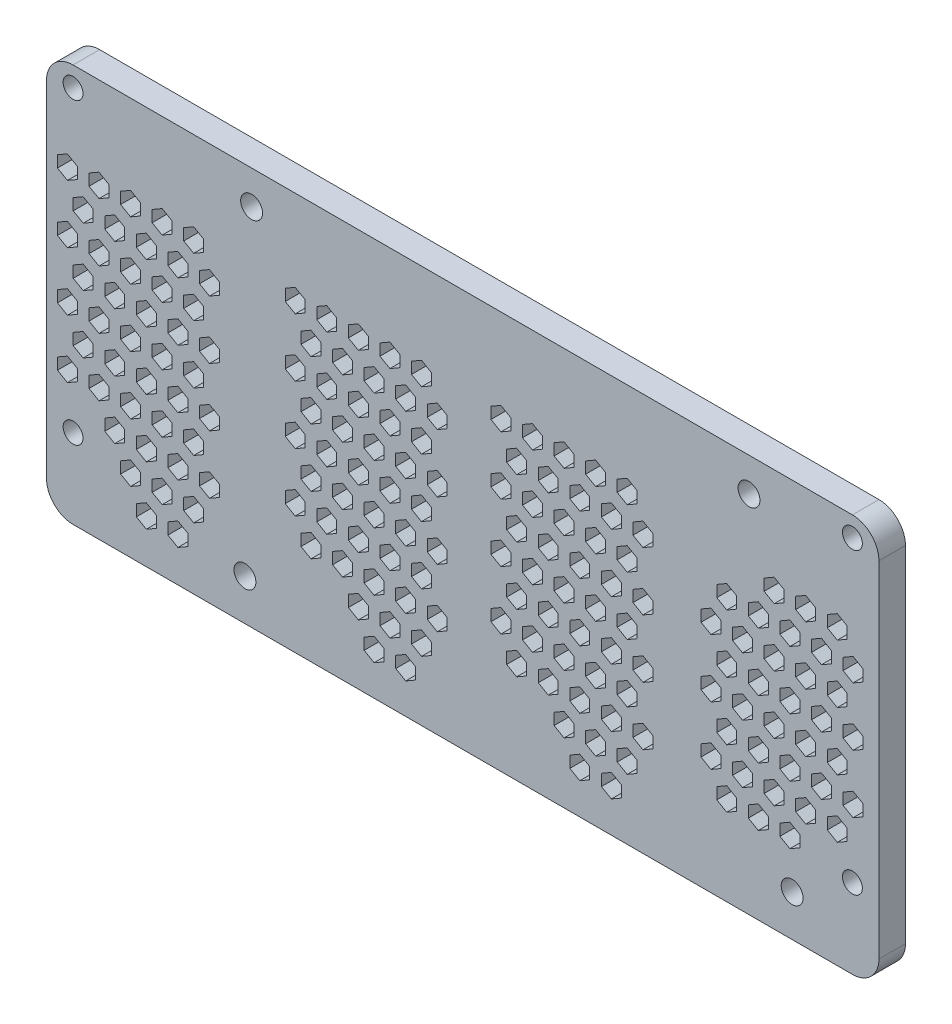
from build123d import *

# Parameters (mm, degrees)
SKETCH1_R           = 1.5
SKETCH1_R_2         = 1.65
BOSS_EXTRUDE5_DEPTH = 4


with BuildPart() as part:
    # Sketch1 → Boss-Extrude5 (new body)
    with BuildSketch(Plane.XY):
        with BuildLine():
            Line((-44, 25.588235294), (73.5, 25.588235294))
            ThreePointArc((73.5, 25.588235294), (76.328427125, 24.416662419), (77.5, 21.588235294))
            Line((77.5, 21.588235294), (77.5, -30.411764706))
            ThreePointArc((77.5, -30.411764706), (76.328427125, -33.240191831), (73.5, -34.411764706))
            Line((73.5, -34.411764706), (-44, -34.411764706))
            ThreePointArc((-44, -34.411764706), (-46.828427125, -33.240191831), (-48, -30.411764706))
            Line((-48, -30.411764706), (-48, 21.588235294))
            ThreePointArc((-48, 21.588235294), (-46.828427125, 24.416662419), (-44, 25.588235294))
        make_face()
        with Locations((-44, 22.588235294)):
            Circle(SKETCH1_R, mode=Mode.SUBTRACT)
        with Locations((73.5, 22.588235294)):
            Circle(SKETCH1_R, mode=Mode.SUBTRACT)
        with Locations((-44, -22.411764706)):
            Circle(SKETCH1_R, mode=Mode.SUBTRACT)
        with Locations((73.5, -22.411764706)):
            Circle(SKETCH1_R, mode=Mode.SUBTRACT)
        with Locations((-17.085026636, 20.514793381)):
            Circle(SKETCH1_R_2, mode=Mode.SUBTRACT)
        with Locations((-18.085026636, -28.185206619)):
            Circle(SKETCH1_R_2, mode=Mode.SUBTRACT)
        with Locations((57.914973364, 20.514793381)):
            Circle(SKETCH1_R_2, mode=Mode.SUBTRACT)
        with Locations((64.414973364, -28.181764706)):
            Circle(SKETCH1_R_2, mode=Mode.SUBTRACT)
        Polygon((-44.8542361, 13.546846171), (-46.3542361, 12.680820767), (-46.3542361, 10.948769959), (-44.8542361, 10.082744555), (-43.3542361, 10.948769959), (-43.3542361, 12.680820767), align=None, mode=Mode.SUBTRACT)
        Polygon((-42.478591753, 9.144922382), (-43.978591753, 8.278896978), (-43.978591753, 6.546846171), (-42.478591753, 5.680820767), (-40.978591753, 6.546846171), (-40.978591753, 8.278896978), align=None, mode=Mode.SUBTRACT)
        Polygon((-40.0942361, 13.546846171), (-41.5942361, 12.680820767), (-41.5942361, 10.948769959), (-40.0942361, 10.082744555), (-38.5942361, 10.948769959), (-38.5942361, 12.680820767), align=None, mode=Mode.SUBTRACT)
        Polygon((-37.718591753, 9.144922382), (-39.218591753, 8.278896978), (-39.218591753, 6.546846171), (-37.718591753, 5.680820767), (-36.218591753, 6.546846171), (-36.218591753, 8.278896978), align=None, mode=Mode.SUBTRACT)
        Polygon((-35.3342361, 13.546846171), (-36.8342361, 12.680820767), (-36.8342361, 10.948769959), (-35.3342361, 10.082744555), (-33.8342361, 10.948769959), (-33.8342361, 12.680820767), align=None, mode=Mode.SUBTRACT)
        Polygon((-32.958591753, 9.144922382), (-34.458591753, 8.278896978), (-34.458591753, 6.546846171), (-32.958591753, 5.680820767), (-31.458591753, 6.546846171), (-31.458591753, 8.278896978), align=None, mode=Mode.SUBTRACT)
        Polygon((-30.5742361, 13.546846171), (-32.0742361, 12.680820767), (-32.0742361, 10.948769959), (-30.5742361, 10.082744555), (-29.0742361, 10.948769959), (-29.0742361, 12.680820767), align=None, mode=Mode.SUBTRACT)
        Polygon((-28.198591753, 9.144922382), (-29.698591753, 8.278896978), (-29.698591753, 6.546846171), (-28.198591753, 5.680820767), (-26.698591753, 6.546846171), (-26.698591753, 8.278896978), align=None, mode=Mode.SUBTRACT)
        Polygon((-25.8142361, 13.546846171), (-27.3142361, 12.680820767), (-27.3142361, 10.948769959), (-25.8142361, 10.082744555), (-24.3142361, 10.948769959), (-24.3142361, 12.680820767), align=None, mode=Mode.SUBTRACT)
        Polygon((-23.438591753, 9.144922382), (-24.938591753, 8.278896978), (-24.938591753, 6.546846171), (-23.438591753, 5.680820767), (-21.938591753, 6.546846171), (-21.938591753, 8.278896978), align=None, mode=Mode.SUBTRACT)
        Polygon((-40.0942361, 4.746846171), (-41.5942361, 3.880820767), (-41.5942361, 2.148769959), (-40.0942361, 1.282744555), (-38.5942361, 2.148769959), (-38.5942361, 3.880820767), align=None, mode=Mode.SUBTRACT)
        Polygon((-37.718591753, 0.344922382), (-39.218591753, -0.521103022), (-39.218591753, -2.253153829), (-37.718591753, -3.119179233), (-36.218591753, -2.253153829), (-36.218591753, -0.521103022), align=None, mode=Mode.SUBTRACT)
        Polygon((-35.3342361, 4.746846171), (-36.8342361, 3.880820767), (-36.8342361, 2.148769959), (-35.3342361, 1.282744555), (-33.8342361, 2.148769959), (-33.8342361, 3.880820767), align=None, mode=Mode.SUBTRACT)
        Polygon((-32.958591753, 0.344922382), (-34.458591753, -0.521103022), (-34.458591753, -2.253153829), (-32.958591753, -3.119179233), (-31.458591753, -2.253153829), (-31.458591753, -0.521103022), align=None, mode=Mode.SUBTRACT)
        Polygon((-30.5742361, 4.746846171), (-32.0742361, 3.880820767), (-32.0742361, 2.148769959), (-30.5742361, 1.282744555), (-29.0742361, 2.148769959), (-29.0742361, 3.880820767), align=None, mode=Mode.SUBTRACT)
        Polygon((-28.198591753, 0.344922382), (-29.698591753, -0.521103022), (-29.698591753, -2.253153829), (-28.198591753, -3.119179233), (-26.698591753, -2.253153829), (-26.698591753, -0.521103022), align=None, mode=Mode.SUBTRACT)
        Polygon((-25.8142361, 4.746846171), (-27.3142361, 3.880820767), (-27.3142361, 2.148769959), (-25.8142361, 1.282744555), (-24.3142361, 2.148769959), (-24.3142361, 3.880820767), align=None, mode=Mode.SUBTRACT)
        Polygon((-23.438591753, 0.344922382), (-24.938591753, -0.521103022), (-24.938591753, -2.253153829), (-23.438591753, -3.119179233), (-21.938591753, -2.253153829), (-21.938591753, -0.521103022), align=None, mode=Mode.SUBTRACT)
        Polygon((-40.0942361, -4.053153829), (-41.5942361, -4.919179233), (-41.5942361, -6.651230041), (-40.0942361, -7.517255445), (-38.5942361, -6.651230041), (-38.5942361, -4.919179233), align=None, mode=Mode.SUBTRACT)
        Polygon((-37.718591753, -8.455077618), (-39.218591753, -9.321103022), (-39.218591753, -11.053153829), (-37.718591753, -11.919179233), (-36.218591753, -11.053153829), (-36.218591753, -9.321103022), align=None, mode=Mode.SUBTRACT)
        Polygon((-35.3342361, -4.053153829), (-36.8342361, -4.919179233), (-36.8342361, -6.651230041), (-35.3342361, -7.517255445), (-33.8342361, -6.651230041), (-33.8342361, -4.919179233), align=None, mode=Mode.SUBTRACT)
        Polygon((-32.958591753, -8.455077618), (-34.458591753, -9.321103022), (-34.458591753, -11.053153829), (-32.958591753, -11.919179233), (-31.458591753, -11.053153829), (-31.458591753, -9.321103022), align=None, mode=Mode.SUBTRACT)
        Polygon((-30.5742361, -4.053153829), (-32.0742361, -4.919179233), (-32.0742361, -6.651230041), (-30.5742361, -7.517255445), (-29.0742361, -6.651230041), (-29.0742361, -4.919179233), align=None, mode=Mode.SUBTRACT)
        Polygon((-28.198591753, -8.455077618), (-29.698591753, -9.321103022), (-29.698591753, -11.053153829), (-28.198591753, -11.919179233), (-26.698591753, -11.053153829), (-26.698591753, -9.321103022), align=None, mode=Mode.SUBTRACT)
        Polygon((-25.8142361, -4.053153829), (-27.3142361, -4.919179233), (-27.3142361, -6.651230041), (-25.8142361, -7.517255445), (-24.3142361, -6.651230041), (-24.3142361, -4.919179233), align=None, mode=Mode.SUBTRACT)
        Polygon((-23.438591753, -8.455077618), (-24.938591753, -9.321103022), (-24.938591753, -11.053153829), (-23.438591753, -11.919179233), (-21.938591753, -11.053153829), (-21.938591753, -9.321103022), align=None, mode=Mode.SUBTRACT)
        Polygon((-40.0942361, -12.853153829), (-41.5942361, -13.719179233), (-41.5942361, -15.451230041), (-40.0942361, -16.317255445), (-38.5942361, -15.451230041), (-38.5942361, -13.719179233), align=None, mode=Mode.SUBTRACT)
        Polygon((-37.718591753, -17.255077618), (-39.218591753, -18.121103022), (-39.218591753, -19.853153829), (-37.718591753, -20.719179233), (-36.218591753, -19.853153829), (-36.218591753, -18.121103022), align=None, mode=Mode.SUBTRACT)
        Polygon((-35.3342361, -12.853153829), (-36.8342361, -13.719179233), (-36.8342361, -15.451230041), (-35.3342361, -16.317255445), (-33.8342361, -15.451230041), (-33.8342361, -13.719179233), align=None, mode=Mode.SUBTRACT)
        Polygon((-32.958591753, -17.255077618), (-34.458591753, -18.121103022), (-34.458591753, -19.853153829), (-32.958591753, -20.719179233), (-31.458591753, -19.853153829), (-31.458591753, -18.121103022), align=None, mode=Mode.SUBTRACT)
        Polygon((-30.5742361, -12.853153829), (-32.0742361, -13.719179233), (-32.0742361, -15.451230041), (-30.5742361, -16.317255445), (-29.0742361, -15.451230041), (-29.0742361, -13.719179233), align=None, mode=Mode.SUBTRACT)
        Polygon((-28.198591753, -17.255077618), (-29.698591753, -18.121103022), (-29.698591753, -19.853153829), (-28.198591753, -20.719179233), (-26.698591753, -19.853153829), (-26.698591753, -18.121103022), align=None, mode=Mode.SUBTRACT)
        Polygon((-25.8142361, -12.853153829), (-27.3142361, -13.719179233), (-27.3142361, -15.451230041), (-25.8142361, -16.317255445), (-24.3142361, -15.451230041), (-24.3142361, -13.719179233), align=None, mode=Mode.SUBTRACT)
        Polygon((-23.438591753, -17.255077618), (-24.938591753, -18.121103022), (-24.938591753, -19.853153829), (-23.438591753, -20.719179233), (-21.938591753, -19.853153829), (-21.938591753, -18.121103022), align=None, mode=Mode.SUBTRACT)
        Polygon((-35.3342361, -21.653153829), (-36.8342361, -22.519179233), (-36.8342361, -24.251230041), (-35.3342361, -25.117255445), (-33.8342361, -24.251230041), (-33.8342361, -22.519179233), align=None, mode=Mode.SUBTRACT)
        Polygon((-32.958591753, -26.055077618), (-34.458591753, -26.921103022), (-34.458591753, -28.653153829), (-32.958591753, -29.519179233), (-31.458591753, -28.653153829), (-31.458591753, -26.921103022), align=None, mode=Mode.SUBTRACT)
        Polygon((-30.5742361, -21.653153829), (-32.0742361, -22.519179233), (-32.0742361, -24.251230041), (-30.5742361, -25.117255445), (-29.0742361, -24.251230041), (-29.0742361, -22.519179233), align=None, mode=Mode.SUBTRACT)
        Polygon((-28.198591753, -26.055077618), (-29.698591753, -26.921103022), (-29.698591753, -28.653153829), (-28.198591753, -29.519179233), (-26.698591753, -28.653153829), (-26.698591753, -26.921103022), align=None, mode=Mode.SUBTRACT)
        Polygon((-25.8142361, -21.653153829), (-27.3142361, -22.519179233), (-27.3142361, -24.251230041), (-25.8142361, -25.117255445), (-24.3142361, -24.251230041), (-24.3142361, -22.519179233), align=None, mode=Mode.SUBTRACT)
        Polygon((-44.8542361, 4.746846171), (-46.3542361, 3.880820767), (-46.3542361, 2.148769959), (-44.8542361, 1.282744555), (-43.3542361, 2.148769959), (-43.3542361, 3.880820767), align=None, mode=Mode.SUBTRACT)
        Polygon((-42.478591753, 0.344922382), (-43.978591753, -0.521103022), (-43.978591753, -2.253153829), (-42.478591753, -3.119179233), (-40.978591753, -2.253153829), (-40.978591753, -0.521103022), align=None, mode=Mode.SUBTRACT)
        Polygon((-44.8542361, -4.053153829), (-46.3542361, -4.919179233), (-46.3542361, -6.651230041), (-44.8542361, -7.517255445), (-43.3542361, -6.651230041), (-43.3542361, -4.919179233), align=None, mode=Mode.SUBTRACT)
        Polygon((-42.478591753, -8.455077618), (-43.978591753, -9.321103022), (-43.978591753, -11.053153829), (-42.478591753, -11.919179233), (-40.978591753, -11.053153829), (-40.978591753, -9.321103022), align=None, mode=Mode.SUBTRACT)
        Polygon((-44.8542361, -12.853153829), (-46.3542361, -13.719179233), (-46.3542361, -15.451230041), (-44.8542361, -16.317255445), (-43.3542361, -15.451230041), (-43.3542361, -13.719179233), align=None, mode=Mode.SUBTRACT)
        Polygon((54.553412934, 7.152031374), (53.053412934, 6.28600597), (53.053412934, 4.553955163), (54.553412934, 3.687929759), (56.053412934, 4.553955163), (56.053412934, 6.28600597), align=None, mode=Mode.SUBTRACT)
        Polygon((59.313412934, 7.152031374), (57.813412934, 6.28600597), (57.813412934, 4.553955163), (59.313412934, 3.687929759), (60.813412934, 4.553955163), (60.813412934, 6.28600597), align=None, mode=Mode.SUBTRACT)
        Polygon((61.697768587, 11.553955163), (60.197768587, 10.687929759), (60.197768587, 8.955878952), (61.697768587, 8.089853548), (63.197768587, 8.955878952), (63.197768587, 10.687929759), align=None, mode=Mode.SUBTRACT)
        Polygon((64.073412934, 7.152031374), (62.573412934, 6.28600597), (62.573412934, 4.553955163), (64.073412934, 3.687929759), (65.573412934, 4.553955163), (65.573412934, 6.28600597), align=None, mode=Mode.SUBTRACT)
        Polygon((66.457768587, 11.553955163), (64.957768587, 10.687929759), (64.957768587, 8.955878952), (66.457768587, 8.089853548), (67.957768587, 8.955878952), (67.957768587, 10.687929759), align=None, mode=Mode.SUBTRACT)
        Polygon((68.833412934, 7.152031374), (67.333412934, 6.28600597), (67.333412934, 4.553955163), (68.833412934, 3.687929759), (70.333412934, 4.553955163), (70.333412934, 6.28600597), align=None, mode=Mode.SUBTRACT)
        Polygon((71.217768587, 11.553955163), (69.717768587, 10.687929759), (69.717768587, 8.955878952), (71.217768587, 8.089853548), (72.717768587, 8.955878952), (72.717768587, 10.687929759), align=None, mode=Mode.SUBTRACT)
        Polygon((73.593412934, 7.152031374), (72.093412934, 6.28600597), (72.093412934, 4.553955163), (73.593412934, 3.687929759), (75.093412934, 4.553955163), (75.093412934, 6.28600597), align=None, mode=Mode.SUBTRACT)
        Polygon((56.937768587, 2.753955163), (55.437768587, 1.887929759), (55.437768587, 0.155878952), (56.937768587, -0.710146452), (58.437768587, 0.155878952), (58.437768587, 1.887929759), align=None, mode=Mode.SUBTRACT)
        Polygon((59.313412934, -1.647968626), (57.813412934, -2.51399403), (57.813412934, -4.246044837), (59.313412934, -5.112070241), (60.813412934, -4.246044837), (60.813412934, -2.51399403), align=None, mode=Mode.SUBTRACT)
        Polygon((61.697768587, 2.753955163), (60.197768587, 1.887929759), (60.197768587, 0.155878952), (61.697768587, -0.710146452), (63.197768587, 0.155878952), (63.197768587, 1.887929759), align=None, mode=Mode.SUBTRACT)
        Polygon((64.073412934, -1.647968626), (62.573412934, -2.51399403), (62.573412934, -4.246044837), (64.073412934, -5.112070241), (65.573412934, -4.246044837), (65.573412934, -2.51399403), align=None, mode=Mode.SUBTRACT)
        Polygon((66.457768587, 2.753955163), (64.957768587, 1.887929759), (64.957768587, 0.155878952), (66.457768587, -0.710146452), (67.957768587, 0.155878952), (67.957768587, 1.887929759), align=None, mode=Mode.SUBTRACT)
        Polygon((68.833412934, -1.647968626), (67.333412934, -2.51399403), (67.333412934, -4.246044837), (68.833412934, -5.112070241), (70.333412934, -4.246044837), (70.333412934, -2.51399403), align=None, mode=Mode.SUBTRACT)
        Polygon((71.217768587, 2.753955163), (69.717768587, 1.887929759), (69.717768587, 0.155878952), (71.217768587, -0.710146452), (72.717768587, 0.155878952), (72.717768587, 1.887929759), align=None, mode=Mode.SUBTRACT)
        Polygon((73.593412934, -1.647968626), (72.093412934, -2.51399403), (72.093412934, -4.246044837), (73.593412934, -5.112070241), (75.093412934, -4.246044837), (75.093412934, -2.51399403), align=None, mode=Mode.SUBTRACT)
        Polygon((56.937768587, -6.046044837), (55.437768587, -6.912070241), (55.437768587, -8.644121048), (56.937768587, -9.510146452), (58.437768587, -8.644121048), (58.437768587, -6.912070241), align=None, mode=Mode.SUBTRACT)
        Polygon((59.313412934, -10.447968626), (57.813412934, -11.31399403), (57.813412934, -13.046044837), (59.313412934, -13.912070241), (60.813412934, -13.046044837), (60.813412934, -11.31399403), align=None, mode=Mode.SUBTRACT)
        Polygon((61.697768587, -6.046044837), (60.197768587, -6.912070241), (60.197768587, -8.644121048), (61.697768587, -9.510146452), (63.197768587, -8.644121048), (63.197768587, -6.912070241), align=None, mode=Mode.SUBTRACT)
        Polygon((64.073412934, -10.447968626), (62.573412934, -11.31399403), (62.573412934, -13.046044837), (64.073412934, -13.912070241), (65.573412934, -13.046044837), (65.573412934, -11.31399403), align=None, mode=Mode.SUBTRACT)
        Polygon((66.457768587, -6.046044837), (64.957768587, -6.912070241), (64.957768587, -8.644121048), (66.457768587, -9.510146452), (67.957768587, -8.644121048), (67.957768587, -6.912070241), align=None, mode=Mode.SUBTRACT)
        Polygon((68.833412934, -10.447968626), (67.333412934, -11.31399403), (67.333412934, -13.046044837), (68.833412934, -13.912070241), (70.333412934, -13.046044837), (70.333412934, -11.31399403), align=None, mode=Mode.SUBTRACT)
        Polygon((71.217768587, -6.046044837), (69.717768587, -6.912070241), (69.717768587, -8.644121048), (71.217768587, -9.510146452), (72.717768587, -8.644121048), (72.717768587, -6.912070241), align=None, mode=Mode.SUBTRACT)
        Polygon((73.593412934, -10.447968626), (72.093412934, -11.31399403), (72.093412934, -13.046044837), (73.593412934, -13.912070241), (75.093412934, -13.046044837), (75.093412934, -11.31399403), align=None, mode=Mode.SUBTRACT)
        Polygon((56.937768587, -14.846044837), (55.437768587, -15.712070241), (55.437768587, -17.444121048), (56.937768587, -18.310146452), (58.437768587, -17.444121048), (58.437768587, -15.712070241), align=None, mode=Mode.SUBTRACT)
        Polygon((59.313412934, -19.247968626), (57.813412934, -20.11399403), (57.813412934, -21.846044837), (59.313412934, -22.712070241), (60.813412934, -21.846044837), (60.813412934, -20.11399403), align=None, mode=Mode.SUBTRACT)
        Polygon((61.697768587, -14.846044837), (60.197768587, -15.712070241), (60.197768587, -17.444121048), (61.697768587, -18.310146452), (63.197768587, -17.444121048), (63.197768587, -15.712070241), align=None, mode=Mode.SUBTRACT)
        Polygon((64.073412934, -19.247968626), (62.573412934, -20.11399403), (62.573412934, -21.846044837), (64.073412934, -22.712070241), (65.573412934, -21.846044837), (65.573412934, -20.11399403), align=None, mode=Mode.SUBTRACT)
        Polygon((66.457768587, -14.846044837), (64.957768587, -15.712070241), (64.957768587, -17.444121048), (66.457768587, -18.310146452), (67.957768587, -17.444121048), (67.957768587, -15.712070241), align=None, mode=Mode.SUBTRACT)
        Polygon((71.217768587, -14.846044837), (69.717768587, -15.712070241), (69.717768587, -17.444121048), (71.217768587, -18.310146452), (72.717768587, -17.444121048), (72.717768587, -15.712070241), align=None, mode=Mode.SUBTRACT)
        Polygon((52.177768587, 2.753955163), (50.677768587, 1.887929759), (50.677768587, 0.155878952), (52.177768587, -0.710146452), (53.677768587, 0.155878952), (53.677768587, 1.887929759), align=None, mode=Mode.SUBTRACT)
        Polygon((54.553412934, -1.647968626), (53.053412934, -2.51399403), (53.053412934, -4.246044837), (54.553412934, -5.112070241), (56.053412934, -4.246044837), (56.053412934, -2.51399403), align=None, mode=Mode.SUBTRACT)
        Polygon((52.177768587, -6.046044837), (50.677768587, -6.912070241), (50.677768587, -8.644121048), (52.177768587, -9.510146452), (53.677768587, -8.644121048), (53.677768587, -6.912070241), align=None, mode=Mode.SUBTRACT)
        Polygon((54.553412934, -10.447968626), (53.053412934, -11.31399403), (53.053412934, -13.046044837), (54.553412934, -13.912070241), (56.053412934, -13.046044837), (56.053412934, -11.31399403), align=None, mode=Mode.SUBTRACT)
        Polygon((52.177768587, -14.846044837), (50.677768587, -15.712070241), (50.677768587, -17.444121048), (52.177768587, -18.310146452), (53.677768587, -17.444121048), (53.677768587, -15.712070241), align=None, mode=Mode.SUBTRACT)
        Polygon((54.553412934, -19.247968626), (53.053412934, -20.11399403), (53.053412934, -21.846044837), (54.553412934, -22.712070241), (56.053412934, -21.846044837), (56.053412934, -20.11399403), align=None, mode=Mode.SUBTRACT)
        Polygon((-10.509250981, 13.292308193), (-12.009250981, 12.426282789), (-12.009250981, 10.694231982), (-10.509250981, 9.828206578), (-9.009250981, 10.694231982), (-9.009250981, 12.426282789), align=None, mode=Mode.SUBTRACT)
        Polygon((-8.133606634, 8.890384404), (-9.633606634, 8.024359001), (-9.633606634, 6.292308193), (-8.133606634, 5.426282789), (-6.633606634, 6.292308193), (-6.633606634, 8.024359001), align=None, mode=Mode.SUBTRACT)
        Polygon((-5.749250981, 13.292308193), (-7.249250981, 12.426282789), (-7.249250981, 10.694231982), (-5.749250981, 9.828206578), (-4.249250981, 10.694231982), (-4.249250981, 12.426282789), align=None, mode=Mode.SUBTRACT)
        Polygon((-3.373606634, 8.890384404), (-4.873606634, 8.024359001), (-4.873606634, 6.292308193), (-3.373606634, 5.426282789), (-1.873606634, 6.292308193), (-1.873606634, 8.024359001), align=None, mode=Mode.SUBTRACT)
        Polygon((-0.989250981, 13.292308193), (-2.489250981, 12.426282789), (-2.489250981, 10.694231982), (-0.989250981, 9.828206578), (0.510749019, 10.694231982), (0.510749019, 12.426282789), align=None, mode=Mode.SUBTRACT)
        Polygon((1.386393366, 8.890384404), (-0.113606634, 8.024359001), (-0.113606634, 6.292308193), (1.386393366, 5.426282789), (2.886393366, 6.292308193), (2.886393366, 8.024359001), align=None, mode=Mode.SUBTRACT)
        Polygon((3.770749019, 13.292308193), (2.270749019, 12.426282789), (2.270749019, 10.694231982), (3.770749019, 9.828206578), (5.270749019, 10.694231982), (5.270749019, 12.426282789), align=None, mode=Mode.SUBTRACT)
        Polygon((6.146393366, 8.890384404), (4.646393366, 8.024359001), (4.646393366, 6.292308193), (6.146393366, 5.426282789), (7.646393366, 6.292308193), (7.646393366, 8.024359001), align=None, mode=Mode.SUBTRACT)
        Polygon((8.530749019, 13.292308193), (7.030749019, 12.426282789), (7.030749019, 10.694231982), (8.530749019, 9.828206578), (10.030749019, 10.694231982), (10.030749019, 12.426282789), align=None, mode=Mode.SUBTRACT)
        Polygon((10.906393366, 8.890384404), (9.406393366, 8.024359001), (9.406393366, 6.292308193), (10.906393366, 5.426282789), (12.406393366, 6.292308193), (12.406393366, 8.024359001), align=None, mode=Mode.SUBTRACT)
        Polygon((-5.749250981, 4.492308193), (-7.249250981, 3.626282789), (-7.249250981, 1.894231982), (-5.749250981, 1.028206578), (-4.249250981, 1.894231982), (-4.249250981, 3.626282789), align=None, mode=Mode.SUBTRACT)
        Polygon((-3.373606634, 0.090384404), (-4.873606634, -0.775640999), (-4.873606634, -2.507691807), (-3.373606634, -3.373717211), (-1.873606634, -2.507691807), (-1.873606634, -0.775640999), align=None, mode=Mode.SUBTRACT)
        Polygon((-0.989250981, 4.492308193), (-2.489250981, 3.626282789), (-2.489250981, 1.894231982), (-0.989250981, 1.028206578), (0.510749019, 1.894231982), (0.510749019, 3.626282789), align=None, mode=Mode.SUBTRACT)
        Polygon((1.386393366, 0.090384404), (-0.113606634, -0.775640999), (-0.113606634, -2.507691807), (1.386393366, -3.373717211), (2.886393366, -2.507691807), (2.886393366, -0.775640999), align=None, mode=Mode.SUBTRACT)
        Polygon((3.770749019, 4.492308193), (2.270749019, 3.626282789), (2.270749019, 1.894231982), (3.770749019, 1.028206578), (5.270749019, 1.894231982), (5.270749019, 3.626282789), align=None, mode=Mode.SUBTRACT)
        Polygon((6.146393366, 0.090384404), (4.646393366, -0.775640999), (4.646393366, -2.507691807), (6.146393366, -3.373717211), (7.646393366, -2.507691807), (7.646393366, -0.775640999), align=None, mode=Mode.SUBTRACT)
        Polygon((8.530749019, 4.492308193), (7.030749019, 3.626282789), (7.030749019, 1.894231982), (8.530749019, 1.028206578), (10.030749019, 1.894231982), (10.030749019, 3.626282789), align=None, mode=Mode.SUBTRACT)
        Polygon((10.906393366, 0.090384404), (9.406393366, -0.775640999), (9.406393366, -2.507691807), (10.906393366, -3.373717211), (12.406393366, -2.507691807), (12.406393366, -0.775640999), align=None, mode=Mode.SUBTRACT)
        Polygon((-5.749250981, -4.307691807), (-7.249250981, -5.173717211), (-7.249250981, -6.905768018), (-5.749250981, -7.771793422), (-4.249250981, -6.905768018), (-4.249250981, -5.173717211), align=None, mode=Mode.SUBTRACT)
        Polygon((-3.373606634, -8.709615596), (-4.873606634, -9.575640999), (-4.873606634, -11.307691807), (-3.373606634, -12.173717211), (-1.873606634, -11.307691807), (-1.873606634, -9.575640999), align=None, mode=Mode.SUBTRACT)
        Polygon((-0.989250981, -4.307691807), (-2.489250981, -5.173717211), (-2.489250981, -6.905768018), (-0.989250981, -7.771793422), (0.510749019, -6.905768018), (0.510749019, -5.173717211), align=None, mode=Mode.SUBTRACT)
        Polygon((1.386393366, -8.709615596), (-0.113606634, -9.575640999), (-0.113606634, -11.307691807), (1.386393366, -12.173717211), (2.886393366, -11.307691807), (2.886393366, -9.575640999), align=None, mode=Mode.SUBTRACT)
        Polygon((3.770749019, -4.307691807), (2.270749019, -5.173717211), (2.270749019, -6.905768018), (3.770749019, -7.771793422), (5.270749019, -6.905768018), (5.270749019, -5.173717211), align=None, mode=Mode.SUBTRACT)
        Polygon((6.146393366, -8.709615596), (4.646393366, -9.575640999), (4.646393366, -11.307691807), (6.146393366, -12.173717211), (7.646393366, -11.307691807), (7.646393366, -9.575640999), align=None, mode=Mode.SUBTRACT)
        Polygon((8.530749019, -4.307691807), (7.030749019, -5.173717211), (7.030749019, -6.905768018), (8.530749019, -7.771793422), (10.030749019, -6.905768018), (10.030749019, -5.173717211), align=None, mode=Mode.SUBTRACT)
        Polygon((10.906393366, -8.709615596), (9.406393366, -9.575640999), (9.406393366, -11.307691807), (10.906393366, -12.173717211), (12.406393366, -11.307691807), (12.406393366, -9.575640999), align=None, mode=Mode.SUBTRACT)
        Polygon((-5.749250981, -13.107691807), (-7.249250981, -13.973717211), (-7.249250981, -15.705768018), (-5.749250981, -16.571793422), (-4.249250981, -15.705768018), (-4.249250981, -13.973717211), align=None, mode=Mode.SUBTRACT)
        Polygon((-3.373606634, -17.509615596), (-4.873606634, -18.375640999), (-4.873606634, -20.107691807), (-3.373606634, -20.973717211), (-1.873606634, -20.107691807), (-1.873606634, -18.375640999), align=None, mode=Mode.SUBTRACT)
        Polygon((-0.989250981, -13.107691807), (-2.489250981, -13.973717211), (-2.489250981, -15.705768018), (-0.989250981, -16.571793422), (0.510749019, -15.705768018), (0.510749019, -13.973717211), align=None, mode=Mode.SUBTRACT)
        Polygon((1.386393366, -17.509615596), (-0.113606634, -18.375640999), (-0.113606634, -20.107691807), (1.386393366, -20.973717211), (2.886393366, -20.107691807), (2.886393366, -18.375640999), align=None, mode=Mode.SUBTRACT)
        Polygon((3.770749019, -13.107691807), (2.270749019, -13.973717211), (2.270749019, -15.705768018), (3.770749019, -16.571793422), (5.270749019, -15.705768018), (5.270749019, -13.973717211), align=None, mode=Mode.SUBTRACT)
        Polygon((6.146393366, -17.509615596), (4.646393366, -18.375640999), (4.646393366, -20.107691807), (6.146393366, -20.973717211), (7.646393366, -20.107691807), (7.646393366, -18.375640999), align=None, mode=Mode.SUBTRACT)
        Polygon((8.530749019, -13.107691807), (7.030749019, -13.973717211), (7.030749019, -15.705768018), (8.530749019, -16.571793422), (10.030749019, -15.705768018), (10.030749019, -13.973717211), align=None, mode=Mode.SUBTRACT)
        Polygon((10.906393366, -17.509615596), (9.406393366, -18.375640999), (9.406393366, -20.107691807), (10.906393366, -20.973717211), (12.406393366, -20.107691807), (12.406393366, -18.375640999), align=None, mode=Mode.SUBTRACT)
        Polygon((-0.989250981, -21.907691807), (-2.489250981, -22.773717211), (-2.489250981, -24.505768018), (-0.989250981, -25.371793422), (0.510749019, -24.505768018), (0.510749019, -22.773717211), align=None, mode=Mode.SUBTRACT)
        Polygon((1.386393366, -26.309615596), (-0.113606634, -27.175640999), (-0.113606634, -28.907691807), (1.386393366, -29.773717211), (2.886393366, -28.907691807), (2.886393366, -27.175640999), align=None, mode=Mode.SUBTRACT)
        Polygon((3.770749019, -21.907691807), (2.270749019, -22.773717211), (2.270749019, -24.505768018), (3.770749019, -25.371793422), (5.270749019, -24.505768018), (5.270749019, -22.773717211), align=None, mode=Mode.SUBTRACT)
        Polygon((6.146393366, -26.309615596), (4.646393366, -27.175640999), (4.646393366, -28.907691807), (6.146393366, -29.773717211), (7.646393366, -28.907691807), (7.646393366, -27.175640999), align=None, mode=Mode.SUBTRACT)
        Polygon((8.530749019, -21.907691807), (7.030749019, -22.773717211), (7.030749019, -24.505768018), (8.530749019, -25.371793422), (10.030749019, -24.505768018), (10.030749019, -22.773717211), align=None, mode=Mode.SUBTRACT)
        Polygon((-10.509250981, 4.492308193), (-12.009250981, 3.626282789), (-12.009250981, 1.894231982), (-10.509250981, 1.028206578), (-9.009250981, 1.894231982), (-9.009250981, 3.626282789), align=None, mode=Mode.SUBTRACT)
        Polygon((-8.133606634, 0.090384404), (-9.633606634, -0.775640999), (-9.633606634, -2.507691807), (-8.133606634, -3.373717211), (-6.633606634, -2.507691807), (-6.633606634, -0.775640999), align=None, mode=Mode.SUBTRACT)
        Polygon((-10.509250981, -4.307691807), (-12.009250981, -5.173717211), (-12.009250981, -6.905768018), (-10.509250981, -7.771793422), (-9.009250981, -6.905768018), (-9.009250981, -5.173717211), align=None, mode=Mode.SUBTRACT)
        Polygon((-8.133606634, -8.709615596), (-9.633606634, -9.575640999), (-9.633606634, -11.307691807), (-8.133606634, -12.173717211), (-6.633606634, -11.307691807), (-6.633606634, -9.575640999), align=None, mode=Mode.SUBTRACT)
        Polygon((-10.509250981, -13.107691807), (-12.009250981, -13.973717211), (-12.009250981, -15.705768018), (-10.509250981, -16.571793422), (-9.009250981, -15.705768018), (-9.009250981, -13.973717211), align=None, mode=Mode.SUBTRACT)
        Polygon((-8.133606634, -17.509615596), (-9.633606634, -18.375640999), (-9.633606634, -20.107691807), (-8.133606634, -20.973717211), (-6.633606634, -20.107691807), (-6.633606634, -18.375640999), align=None, mode=Mode.SUBTRACT)
        Polygon((20.504407611, 13.391172594), (19.004407611, 12.525147191), (19.004407611, 10.793096383), (20.504407611, 9.927070979), (22.004407611, 10.793096383), (22.004407611, 12.525147191), align=None, mode=Mode.SUBTRACT)
        Polygon((22.880051958, 8.989248806), (21.380051958, 8.123223402), (21.380051958, 6.391172594), (22.880051958, 5.525147191), (24.380051958, 6.391172594), (24.380051958, 8.123223402), align=None, mode=Mode.SUBTRACT)
        Polygon((25.264407611, 13.391172594), (23.764407611, 12.525147191), (23.764407611, 10.793096383), (25.264407611, 9.927070979), (26.764407611, 10.793096383), (26.764407611, 12.525147191), align=None, mode=Mode.SUBTRACT)
        Polygon((27.640051958, 8.989248806), (26.140051958, 8.123223402), (26.140051958, 6.391172594), (27.640051958, 5.525147191), (29.140051958, 6.391172594), (29.140051958, 8.123223402), align=None, mode=Mode.SUBTRACT)
        Polygon((30.024407611, 13.391172594), (28.524407611, 12.525147191), (28.524407611, 10.793096383), (30.024407611, 9.927070979), (31.524407611, 10.793096383), (31.524407611, 12.525147191), align=None, mode=Mode.SUBTRACT)
        Polygon((32.400051958, 8.989248806), (30.900051958, 8.123223402), (30.900051958, 6.391172594), (32.400051958, 5.525147191), (33.900051958, 6.391172594), (33.900051958, 8.123223402), align=None, mode=Mode.SUBTRACT)
        Polygon((34.784407611, 13.391172594), (33.284407611, 12.525147191), (33.284407611, 10.793096383), (34.784407611, 9.927070979), (36.284407611, 10.793096383), (36.284407611, 12.525147191), align=None, mode=Mode.SUBTRACT)
        Polygon((37.160051958, 8.989248806), (35.660051958, 8.123223402), (35.660051958, 6.391172594), (37.160051958, 5.525147191), (38.660051958, 6.391172594), (38.660051958, 8.123223402), align=None, mode=Mode.SUBTRACT)
        Polygon((39.544407611, 13.391172594), (38.044407611, 12.525147191), (38.044407611, 10.793096383), (39.544407611, 9.927070979), (41.044407611, 10.793096383), (41.044407611, 12.525147191), align=None, mode=Mode.SUBTRACT)
        Polygon((41.920051958, 8.989248806), (40.420051958, 8.123223402), (40.420051958, 6.391172594), (41.920051958, 5.525147191), (43.420051958, 6.391172594), (43.420051958, 8.123223402), align=None, mode=Mode.SUBTRACT)
        Polygon((25.264407611, 4.591172594), (23.764407611, 3.725147191), (23.764407611, 1.993096383), (25.264407611, 1.127070979), (26.764407611, 1.993096383), (26.764407611, 3.725147191), align=None, mode=Mode.SUBTRACT)
        Polygon((27.640051958, 0.189248806), (26.140051958, -0.676776598), (26.140051958, -2.408827406), (27.640051958, -3.274852809), (29.140051958, -2.408827406), (29.140051958, -0.676776598), align=None, mode=Mode.SUBTRACT)
        Polygon((30.024407611, 4.591172594), (28.524407611, 3.725147191), (28.524407611, 1.993096383), (30.024407611, 1.127070979), (31.524407611, 1.993096383), (31.524407611, 3.725147191), align=None, mode=Mode.SUBTRACT)
        Polygon((32.400051958, 0.189248806), (30.900051958, -0.676776598), (30.900051958, -2.408827406), (32.400051958, -3.274852809), (33.900051958, -2.408827406), (33.900051958, -0.676776598), align=None, mode=Mode.SUBTRACT)
        Polygon((34.784407611, 4.591172594), (33.284407611, 3.725147191), (33.284407611, 1.993096383), (34.784407611, 1.127070979), (36.284407611, 1.993096383), (36.284407611, 3.725147191), align=None, mode=Mode.SUBTRACT)
        Polygon((37.160051958, 0.189248806), (35.660051958, -0.676776598), (35.660051958, -2.408827406), (37.160051958, -3.274852809), (38.660051958, -2.408827406), (38.660051958, -0.676776598), align=None, mode=Mode.SUBTRACT)
        Polygon((39.544407611, 4.591172594), (38.044407611, 3.725147191), (38.044407611, 1.993096383), (39.544407611, 1.127070979), (41.044407611, 1.993096383), (41.044407611, 3.725147191), align=None, mode=Mode.SUBTRACT)
        Polygon((41.920051958, 0.189248806), (40.420051958, -0.676776598), (40.420051958, -2.408827406), (41.920051958, -3.274852809), (43.420051958, -2.408827406), (43.420051958, -0.676776598), align=None, mode=Mode.SUBTRACT)
        Polygon((25.264407611, -4.208827406), (23.764407611, -5.074852809), (23.764407611, -6.806903617), (25.264407611, -7.672929021), (26.764407611, -6.806903617), (26.764407611, -5.074852809), align=None, mode=Mode.SUBTRACT)
        Polygon((27.640051958, -8.610751194), (26.140051958, -9.476776598), (26.140051958, -11.208827406), (27.640051958, -12.074852809), (29.140051958, -11.208827406), (29.140051958, -9.476776598), align=None, mode=Mode.SUBTRACT)
        Polygon((30.024407611, -4.208827406), (28.524407611, -5.074852809), (28.524407611, -6.806903617), (30.024407611, -7.672929021), (31.524407611, -6.806903617), (31.524407611, -5.074852809), align=None, mode=Mode.SUBTRACT)
        Polygon((32.400051958, -8.610751194), (30.900051958, -9.476776598), (30.900051958, -11.208827406), (32.400051958, -12.074852809), (33.900051958, -11.208827406), (33.900051958, -9.476776598), align=None, mode=Mode.SUBTRACT)
        Polygon((34.784407611, -4.208827406), (33.284407611, -5.074852809), (33.284407611, -6.806903617), (34.784407611, -7.672929021), (36.284407611, -6.806903617), (36.284407611, -5.074852809), align=None, mode=Mode.SUBTRACT)
        Polygon((37.160051958, -8.610751194), (35.660051958, -9.476776598), (35.660051958, -11.208827406), (37.160051958, -12.074852809), (38.660051958, -11.208827406), (38.660051958, -9.476776598), align=None, mode=Mode.SUBTRACT)
        Polygon((39.544407611, -4.208827406), (38.044407611, -5.074852809), (38.044407611, -6.806903617), (39.544407611, -7.672929021), (41.044407611, -6.806903617), (41.044407611, -5.074852809), align=None, mode=Mode.SUBTRACT)
        Polygon((41.920051958, -8.610751194), (40.420051958, -9.476776598), (40.420051958, -11.208827406), (41.920051958, -12.074852809), (43.420051958, -11.208827406), (43.420051958, -9.476776598), align=None, mode=Mode.SUBTRACT)
        Polygon((25.264407611, -13.008827406), (23.764407611, -13.874852809), (23.764407611, -15.606903617), (25.264407611, -16.472929021), (26.764407611, -15.606903617), (26.764407611, -13.874852809), align=None, mode=Mode.SUBTRACT)
        Polygon((27.640051958, -17.410751194), (26.140051958, -18.276776598), (26.140051958, -20.008827406), (27.640051958, -20.874852809), (29.140051958, -20.008827406), (29.140051958, -18.276776598), align=None, mode=Mode.SUBTRACT)
        Polygon((30.024407611, -13.008827406), (28.524407611, -13.874852809), (28.524407611, -15.606903617), (30.024407611, -16.472929021), (31.524407611, -15.606903617), (31.524407611, -13.874852809), align=None, mode=Mode.SUBTRACT)
        Polygon((32.400051958, -17.410751194), (30.900051958, -18.276776598), (30.900051958, -20.008827406), (32.400051958, -20.874852809), (33.900051958, -20.008827406), (33.900051958, -18.276776598), align=None, mode=Mode.SUBTRACT)
        Polygon((34.784407611, -13.008827406), (33.284407611, -13.874852809), (33.284407611, -15.606903617), (34.784407611, -16.472929021), (36.284407611, -15.606903617), (36.284407611, -13.874852809), align=None, mode=Mode.SUBTRACT)
        Polygon((37.160051958, -17.410751194), (35.660051958, -18.276776598), (35.660051958, -20.008827406), (37.160051958, -20.874852809), (38.660051958, -20.008827406), (38.660051958, -18.276776598), align=None, mode=Mode.SUBTRACT)
        Polygon((39.544407611, -13.008827406), (38.044407611, -13.874852809), (38.044407611, -15.606903617), (39.544407611, -16.472929021), (41.044407611, -15.606903617), (41.044407611, -13.874852809), align=None, mode=Mode.SUBTRACT)
        Polygon((41.920051958, -17.410751194), (40.420051958, -18.276776598), (40.420051958, -20.008827406), (41.920051958, -20.874852809), (43.420051958, -20.008827406), (43.420051958, -18.276776598), align=None, mode=Mode.SUBTRACT)
        Polygon((30.024407611, -21.808827406), (28.524407611, -22.674852809), (28.524407611, -24.406903617), (30.024407611, -25.272929021), (31.524407611, -24.406903617), (31.524407611, -22.674852809), align=None, mode=Mode.SUBTRACT)
        Polygon((32.400051958, -26.210751194), (30.900051958, -27.076776598), (30.900051958, -28.808827406), (32.400051958, -29.674852809), (33.900051958, -28.808827406), (33.900051958, -27.076776598), align=None, mode=Mode.SUBTRACT)
        Polygon((34.784407611, -21.808827406), (33.284407611, -22.674852809), (33.284407611, -24.406903617), (34.784407611, -25.272929021), (36.284407611, -24.406903617), (36.284407611, -22.674852809), align=None, mode=Mode.SUBTRACT)
        Polygon((37.160051958, -26.210751194), (35.660051958, -27.076776598), (35.660051958, -28.808827406), (37.160051958, -29.674852809), (38.660051958, -28.808827406), (38.660051958, -27.076776598), align=None, mode=Mode.SUBTRACT)
        Polygon((39.544407611, -21.808827406), (38.044407611, -22.674852809), (38.044407611, -24.406903617), (39.544407611, -25.272929021), (41.044407611, -24.406903617), (41.044407611, -22.674852809), align=None, mode=Mode.SUBTRACT)
        Polygon((20.504407611, 4.591172594), (19.004407611, 3.725147191), (19.004407611, 1.993096383), (20.504407611, 1.127070979), (22.004407611, 1.993096383), (22.004407611, 3.725147191), align=None, mode=Mode.SUBTRACT)
        Polygon((22.880051958, 0.189248806), (21.380051958, -0.676776598), (21.380051958, -2.408827406), (22.880051958, -3.274852809), (24.380051958, -2.408827406), (24.380051958, -0.676776598), align=None, mode=Mode.SUBTRACT)
        Polygon((20.504407611, -4.208827406), (19.004407611, -5.074852809), (19.004407611, -6.806903617), (20.504407611, -7.672929021), (22.004407611, -6.806903617), (22.004407611, -5.074852809), align=None, mode=Mode.SUBTRACT)
        Polygon((22.880051958, -8.610751194), (21.380051958, -9.476776598), (21.380051958, -11.208827406), (22.880051958, -12.074852809), (24.380051958, -11.208827406), (24.380051958, -9.476776598), align=None, mode=Mode.SUBTRACT)
        Polygon((20.504407611, -13.008827406), (19.004407611, -13.874852809), (19.004407611, -15.606903617), (20.504407611, -16.472929021), (22.004407611, -15.606903617), (22.004407611, -13.874852809), align=None, mode=Mode.SUBTRACT)
        Polygon((22.880051958, -17.410751194), (21.380051958, -18.276776598), (21.380051958, -20.008827406), (22.880051958, -20.874852809), (24.380051958, -20.008827406), (24.380051958, -18.276776598), align=None, mode=Mode.SUBTRACT)
    extrude(amount=BOSS_EXTRUDE5_DEPTH)


solid = part.part
